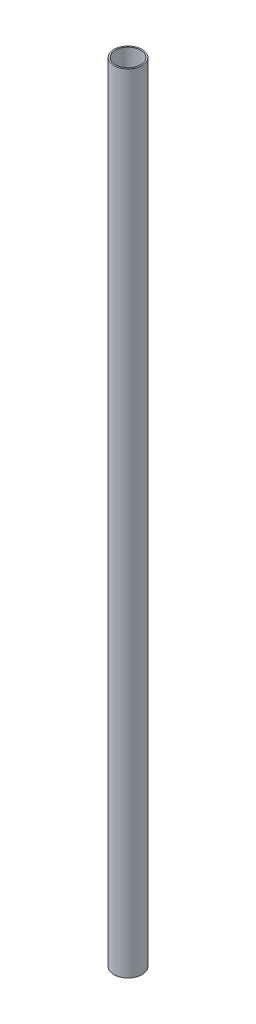
from build123d import *

# Parameters (mm, degrees)
SKETCH1_R           = 6.35
SKETCH1_R_2         = 5.715
BOSS_EXTRUDE1_DEPTH = 355.6


with BuildPart() as part:
    # Sketch1 → Boss-Extrude1 (new body)
    with BuildSketch(Plane(origin=(0, 0, 0), x_dir=(1, 0, 0), z_dir=(0, 1, 0))):
        Circle(SKETCH1_R)
        Circle(SKETCH1_R_2, mode=Mode.SUBTRACT)
    extrude(amount=BOSS_EXTRUDE1_DEPTH)


solid = part.part
